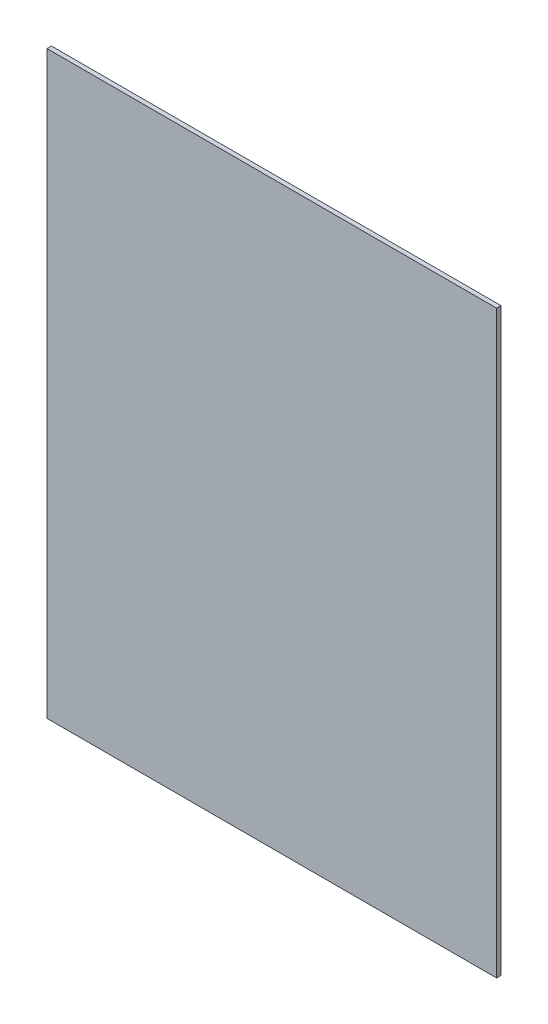
from build123d import *

# Parameters (mm, degrees)
SKETCH1_W                 = 155
SKETCH1_H                 = 200
BOTTOM_OUTER_CASING_DEPTH = 1.51892


with BuildPart() as part:
    # Sketch1 → Bottom Outer Casing (new body)
    with BuildSketch(Plane.XY):
        with Locations((77.5, 100)):
            Rectangle(SKETCH1_W, SKETCH1_H)
    extrude(amount=BOTTOM_OUTER_CASING_DEPTH)


solid = part.part
